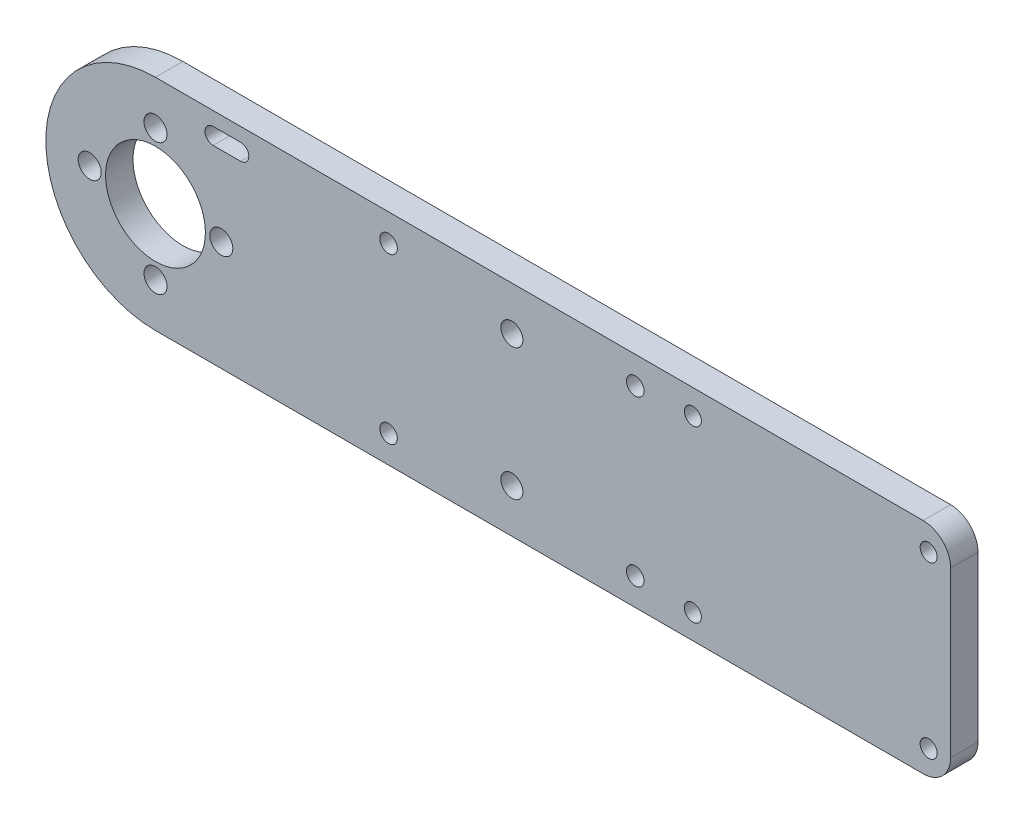
from build123d import *

# Parameters (mm, degrees)
SKETCH2_R           = 9.1
BOSS_EXTRUDE1_DEPTH = 2.5
FILLET1_R           = 5
SKETCH3_R           = 2.1
CUT_EXTRUDE1_DEPTH  = 147.458185159
SKETCH3_4_R         = 1.55
SKETCH3_4_R_2       = 1.6
SKETCH3_4_R_3       = 2
CUT_EXTRUDE2_DEPTH  = 10


with BuildPart() as part:
    # Sketch2 → Boss-Extrude1 (new, symmetric)
    with BuildSketch(Plane.XY):
        with BuildLine():
            Line((145, 20), (0, 20))
            ThreePointArc((0, 20), (-20, 0), (0, -20))
            Line((0, -20), (145, -20))
            Line((145, -20), (145, 20))
        make_face()
        Circle(SKETCH2_R, mode=Mode.SUBTRACT)
    extrude(amount=BOSS_EXTRUDE1_DEPTH, both=True)

    # Fillet1
    fillet1_edges = [part.edges().sort_by_distance(p)[0] for p in [
        (145, -20, 0),
        (145, 20, 0),
    ]]
    fillet(fillet1_edges, radius=FILLET1_R)

    # Sketch3 → Cut-Extrude1 (cut, through all)
    with BuildSketch(Plane(origin=(0, 0, -2.5), x_dir=(-1, 0, 0), z_dir=(0, 0, -1))):
        with Locations((-12, 0)):
            Circle(SKETCH3_R)
        with Locations((0, 12)):
            Circle(SKETCH3_R)
        with Locations((0, -12)):
            Circle(SKETCH3_R)
        with Locations((12, 0)):
            Circle(SKETCH3_R)
    extrude(amount=-CUT_EXTRUDE1_DEPTH, mode=Mode.SUBTRACT)

    # Sketch3<4> → Cut-Extrude2 (cut)
    with BuildSketch(Plane(origin=(0, 0, -2.5), x_dir=(-1, 0, 0), z_dir=(0, 0, -1))):
        with Locations((-98, 15.5)):
            Circle(SKETCH3_4_R)
        with Locations((-87.5, 15)):
            Circle(SKETCH3_4_R_2)
        with Locations((-65, 12)):
            Circle(SKETCH3_4_R_3)
        with BuildLine():
            Line((-10.518524874, 17.5), (-15.518524874, 17.5))
            ThreePointArc((-15.518524874, 17.5), (-17.018524874, 16), (-15.518524874, 14.5))
            Line((-15.518524874, 14.5), (-10.518524874, 14.5))
            ThreePointArc((-10.518524874, 14.5), (-9.018524874, 16), (-10.518524874, 17.5))
        make_face()
        with Locations((-98, -15.5)):
            Circle(SKETCH3_4_R)
        with Locations((-141, -15.5)):
            Circle(SKETCH3_4_R)
        with Locations((-141, 15.5)):
            Circle(SKETCH3_4_R)
        with Locations((-87.5, -15)):
            Circle(SKETCH3_4_R_2)
        with Locations((-42.5, -15)):
            Circle(SKETCH3_4_R_2)
        with Locations((-42.5, 15)):
            Circle(SKETCH3_4_R_2)
        with Locations((-65, -12)):
            Circle(SKETCH3_4_R_3)
    extrude(amount=-CUT_EXTRUDE2_DEPTH, mode=Mode.SUBTRACT)


solid = part.part
